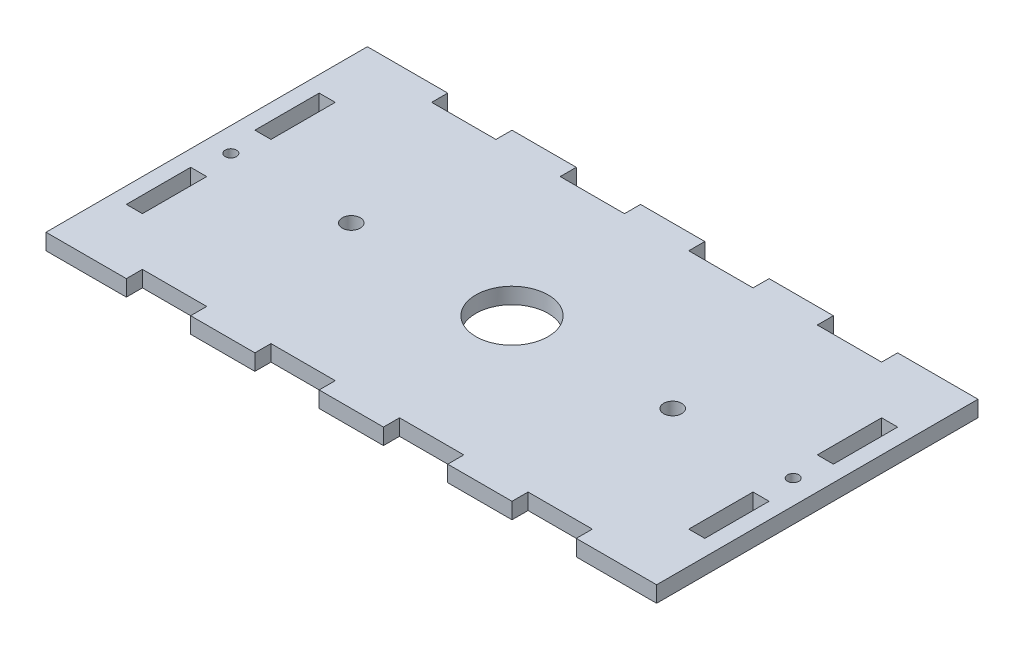
from build123d import *

# Parameters (mm, degrees)
SKETCH1_W                 = 241.3
SKETCH1_H                 = 127
BOSS_EXTRUDE1_DEPTH       = 6.35
SKETCH13_W                = 25.4
SKETCH13_H                = 6.35
CUT_EXTRUDE6_DEPTH        = 6.35
LPATTERN7_COUNT           = 2
LPATTERN7_PITCH           = 120.65
SKETCH14_W                = 6.35
SKETCH14_H                = 25.4
CUT_EXTRUDE7_DEPTH        = 6.35
F_8_CLEARANCE_HOLE1_D     = 4.4958
F_8_CLEARANCE_HOLE1_DEPTH = 10.16
F_8_CLEARANCE_HOLE1_TIP   = 1.350674586
SKETCH18_R                = 14.2875
CUT_EXTRUDE9_DEPTH        = 7.62
SKETCH19_R                = 3.571875
CUT_EXTRUDE10_DEPTH       = 7.62


with BuildPart() as part:
    # Sketch1 → Boss-Extrude1 (new body)
    with BuildSketch(Plane(origin=(0, 0, 0), x_dir=(1, 0, 0), z_dir=(0, 1, 0))):
        with Locations((120.65, 63.5)):
            Rectangle(SKETCH1_W, SKETCH1_H)
    extrude(amount=BOSS_EXTRUDE1_DEPTH)

    # Sketch13 → Cut-Extrude6 (cut)
    with BuildSketch(Plane(origin=(0, 6.35, 0), x_dir=(1, 0, 0), z_dir=(0, 1, 0))):
        with Locations((44.45, 3.175)):
            Rectangle(SKETCH13_W, SKETCH13_H)
        with Locations((95.25, 3.175)):
            Rectangle(SKETCH13_W, SKETCH13_H)
        with Locations((146.05, 3.175)):
            Rectangle(SKETCH13_W, SKETCH13_H)
        with Locations((196.85, 3.175)):
            Rectangle(SKETCH13_W, SKETCH13_H)
    cut_extrude6 = extrude(amount=-CUT_EXTRUDE6_DEPTH, mode=Mode.SUBTRACT)

    # LPattern7: Cut-Extrude6 ×2
    with Locations(*[(0, 0, -i * LPATTERN7_PITCH) for i in range(1, LPATTERN7_COUNT)]):
        add(cut_extrude6, mode=Mode.SUBTRACT)

    # Sketch14 → Cut-Extrude7 (cut)
    with BuildSketch(Plane(origin=(0, 6.35, 0), x_dir=(1, 0, 0), z_dir=(0, 1, 0))):
        with Locations((9.525, 38.1)):
            Rectangle(SKETCH14_W, SKETCH14_H)
        with Locations((231.775, 38.1)):
            Rectangle(SKETCH14_W, SKETCH14_H)
        with Locations((231.775, 88.9)):
            Rectangle(SKETCH14_W, SKETCH14_H)
        with Locations((9.525, 88.9)):
            Rectangle(SKETCH14_W, SKETCH14_H)
    extrude(amount=-CUT_EXTRUDE7_DEPTH, mode=Mode.SUBTRACT)

    # #8 Clearance Hole1
    with Locations(Plane(origin=(0, 6.35, 0), x_dir=(1, 0, 0), z_dir=(0, 1, 0))):
        with Locations((9.525, 63.5), (231.775, 63.5)):
            Hole(F_8_CLEARANCE_HOLE1_D / 2, depth=F_8_CLEARANCE_HOLE1_DEPTH)
            with Locations((0, 0, -(F_8_CLEARANCE_HOLE1_DEPTH + F_8_CLEARANCE_HOLE1_TIP / 2))):  # 118° drill point
                Cone(0, F_8_CLEARANCE_HOLE1_D / 2, F_8_CLEARANCE_HOLE1_TIP, mode=Mode.SUBTRACT)

    # Sketch18 → Cut-Extrude9 (cut)
    with BuildSketch(Plane(origin=(0, 6.35, 0), x_dir=(1, 0, 0), z_dir=(0, 1, 0))):
        with Locations((120.65, 63.5)):
            Circle(SKETCH18_R)
    extrude(amount=-CUT_EXTRUDE9_DEPTH, mode=Mode.SUBTRACT)

    # Sketch19 → Cut-Extrude10 (cut)
    with BuildSketch(Plane(origin=(0, 6.35, 0), x_dir=(1, 0, 0), z_dir=(0, 1, 0))):
        with Locations((57.15, 63.5)):
            Circle(SKETCH19_R)
        with Locations((184.15, 63.5)):
            Circle(SKETCH19_R)
    extrude(amount=-CUT_EXTRUDE10_DEPTH, mode=Mode.SUBTRACT)


solid = part.part
